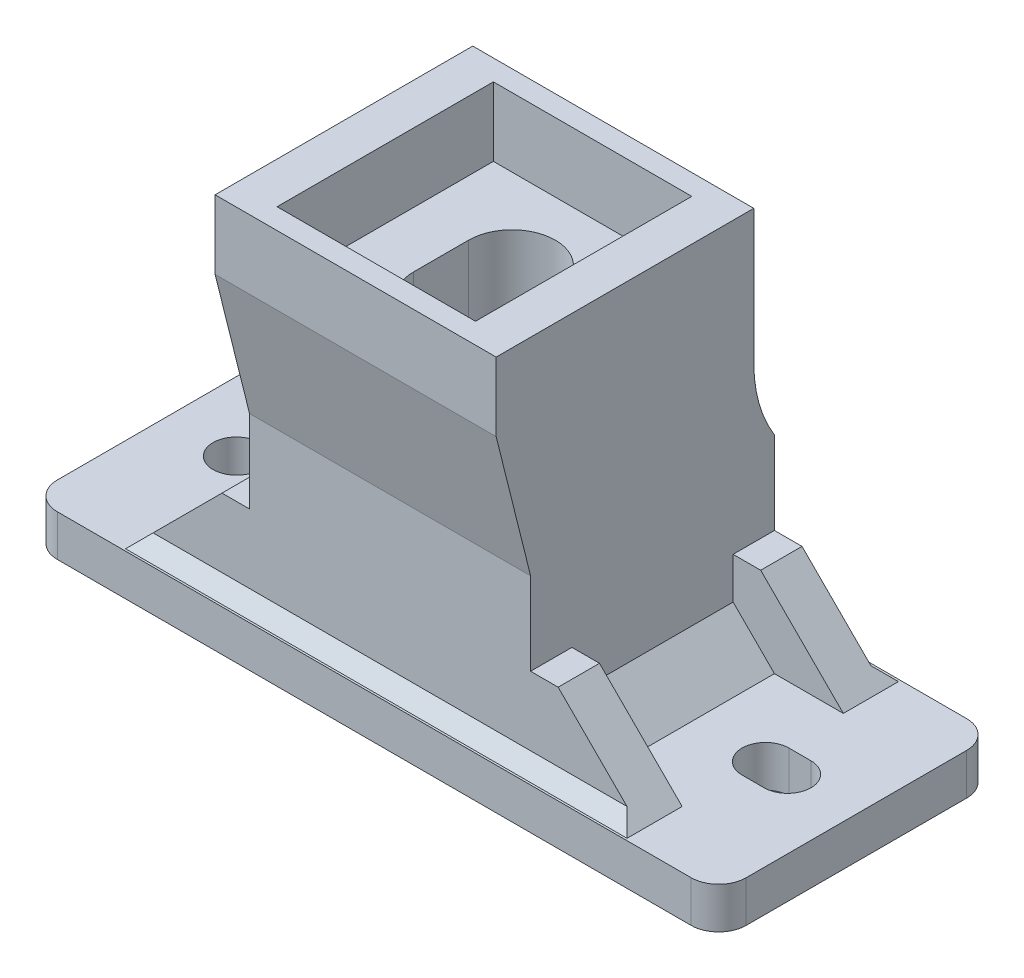
from build123d import *

# Parameters (mm, degrees)
SKETCH1_W               = 20.4
SKETCH1_H               = 17.7
SKETCH1_W_2             = 14.4
SKETCH1_H_2             = 11.7
SKETCH1_R               = 3.15
BOSS_EXTRUDE1_DEPTH     = 25
SKETCH1_3_W             = 20.4
SKETCH1_3_H             = 17.7
SKETCH1_3_W_2           = 14.4
SKETCH1_3_H_2           = 11.7
BOSS_EXTRUDE2_DEPTH     = 30
SKETCH2_W               = 22.449827962
SKETCH2_H               = 3
CUT_EXTRUDE1_DEPTH      = 15
FILLET1_R               = 10
SKETCH3_W               = 50
SKETCH3_H               = 20
SKETCH3_R               = 3.15
BOSS_EXTRUDE3_DEPTH     = 3
SKETCH4_R               = 1.7
CUT_EXTRUDE2_DEPTH      = 39.13135193
BOSS_EXTRUDE4_DEPTH     = 3
BOSS_EXTRUDE5_DEPTH     = 3
CHAMFER1_SIZE           = 3
CHAMFER2_SIZE           = 1
FILLET3_R               = 2
SKETCH7_W               = 14.4
SKETCH7_H               = 3
CUT_EXTRUDE3_DEPTH      = 5
BOSS_EXTRUDE6_DEPTH     = 5
CUT_EXTRUDE4_DEPTH      = 38.132499243
CUT_EXTRUDE4_DEPTH_BACK = 38.132499243
BOSS_EXTRUDE7_DEPTH     = 20.4


with BuildPart() as part:
    # Sketch1 → Boss-Extrude1 (new body)
    # profile 1 of 2: a face of its own
    with BuildSketch(Plane(origin=(0, 0, 0), x_dir=(1, 0, 0), z_dir=(0, 1, 0))):
        Rectangle(SKETCH1_W, SKETCH1_H)
        Rectangle(SKETCH1_W_2, SKETCH1_H_2, mode=Mode.SUBTRACT)
    # profile 2 of 2: a face of its own
    with BuildSketch(Plane(origin=(0, 0, 0), x_dir=(1, 0, 0), z_dir=(0, 1, 0))):
        Rectangle(SKETCH1_W_2, SKETCH1_H_2)
        with Locations(Location((0, 0, 0), (0, 0, 270))):
            Circle(SKETCH1_R, mode=Mode.SUBTRACT)
    extrude(amount=BOSS_EXTRUDE1_DEPTH)

    # Sketch1<3> → Boss-Extrude2 (add)
    with BuildSketch(Plane(origin=(0, 0, 0), x_dir=(1, 0, 0), z_dir=(0, 1, 0))):
        Rectangle(SKETCH1_3_W, SKETCH1_3_H)
        Rectangle(SKETCH1_3_W_2, SKETCH1_3_H_2, mode=Mode.SUBTRACT)
    extrude(amount=BOSS_EXTRUDE2_DEPTH)

    # Sketch2 → Cut-Extrude1 (cut)
    with BuildSketch(Plane(origin=(0, 30, 0), x_dir=(1, 0, 0), z_dir=(0, 1, 0))):
        with Locations((0, 8.85)):
            Rectangle(SKETCH2_W, SKETCH2_H)
    extrude(amount=-CUT_EXTRUDE1_DEPTH, mode=Mode.SUBTRACT)

    # Fillet1
    # the kernel refuses this fillet: 10 mm, written as the material it adds along each edge
    with BuildSketch(Plane(origin=(10.2, 15, -7.35), x_dir=(0, 1, 0), z_dir=(-1, 0, 0))) as fillet1_piece_1:
        with BuildLine():
            CenterArc((5.267826876, 10), FILLET1_R, 238.211669383, 31.788330617)
            Line((0, 1.5), (-0.105356538, 1.33))
            ThreePointArc((-0.105356538, 1.33), (-0.2, 0.75), (-0.2, 0))
            Line((-0.2, 0), (0, -0.2))
            Line((0, -0.2), (5.267826876, -0.2))
            Line((5.267826876, -0.2), (5.267826876, 0))
        make_face()
    extrude(amount=20.4)

    # Sketch3 → Boss-Extrude3 (add)
    with BuildSketch(Plane.XZ):
        Rectangle(SKETCH3_W, SKETCH3_H)
        with Locations(Location((0, 0, 0), (0, 0, 90))):
            Circle(SKETCH3_R, mode=Mode.SUBTRACT)
    extrude(amount=-BOSS_EXTRUDE3_DEPTH)

    # Sketch4 → Cut-Extrude2 (cut, through all)
    with BuildSketch(Plane(origin=(0, 3, 0), x_dir=(1, 0, 0), z_dir=(0, 1, 0))):
        with Locations(Location((-20, 0, 0), (0, 0, 270))):
            Circle(SKETCH4_R)
        with BuildLine():
            Line((18.4, 1.7), (20, 1.7))
            ThreePointArc((20, 1.7), (21.7, 0), (20, -1.7))
            Line((20, -1.7), (18.4, -1.7))
            ThreePointArc((18.4, -1.7), (16.7, 0), (18.4, 1.7))
        make_face()
    extrude(amount=-CUT_EXTRUDE2_DEPTH, mode=Mode.SUBTRACT)

    # Sketch5 → Boss-Extrude4 (add)
    with BuildSketch(Plane(origin=(0, 0, -8.85), x_dir=(-1, 0, 0), z_dir=(0, 0, -1))):
        Polygon((-10.2, 3), (-10.2, 9), (-12.2, 9), (-18.2, 3), align=None)
        Polygon((18.2, 3), (10.2, 3), (10.2, 9), (12.2, 9), align=None)
    extrude(amount=-BOSS_EXTRUDE4_DEPTH)

    # Sketch6 → Boss-Extrude5 (add)
    with BuildSketch(Plane.XY.offset(8.85)):
        Polygon((-18.2, 3), (-10.2, 3), (-10.2, 9), (-12.2, 9), align=None)
        Polygon((10.2, 9), (10.2, 3), (18.2, 3), (12.2, 9), align=None)
    extrude(amount=-BOSS_EXTRUDE5_DEPTH)

    # Chamfer1
    chamfer1_edges = [part.edges().sort_by_distance(p)[0] for p in [
        (-10.2, 3, 0),
        (10.2, 3, 0),
    ]]
    chamfer(chamfer1_edges, length=CHAMFER1_SIZE)

    # Chamfer2
    chamfer2_edges = [part.edges().sort_by_distance(p)[0] for p in [
        (0, 3, -8.85),
        (0, 3, 8.85),
    ]]
    chamfer(chamfer2_edges, length=CHAMFER2_SIZE)

    # Fillet3
    fillet3_edges = [part.edges().sort_by_distance(p)[0] for p in [
        (25, 1.5, 10),
        (25, 1.5, -10),
        (-25, 1.5, -10),
        (-25, 1.5, 10),
    ]]
    fillet(fillet3_edges, radius=FILLET3_R)

    # Sketch7 → Cut-Extrude3 (cut)
    with BuildSketch(Plane(origin=(0, 30, 0), x_dir=(1, 0, 0), z_dir=(0, 1, 0))):
        with Locations((0, -7.35)):
            Rectangle(SKETCH7_W, SKETCH7_H)
    extrude(amount=-CUT_EXTRUDE3_DEPTH, mode=Mode.SUBTRACT)

    # Sketch7<3> → Boss-Extrude6 (add)
    with BuildSketch(Plane(origin=(0, 30, 0), x_dir=(1, 0, 0), z_dir=(0, 1, 0))):
        Polygon((-7.2, -9.85), (-7.2, -8.85), (-10.2, -8.85), (-10.2, -11.35), (10.2, -11.35), (10.2, -8.85), (7.2, -8.85), (7.2, -9.85), align=None)
    extrude(amount=-BOSS_EXTRUDE6_DEPTH)

    # Sketch8 → Cut-Extrude4 (cut, two sides: drawn at the far end of the back side and taken through both)
    with BuildSketch(Plane(origin=(0, 25, 0), x_dir=(1, 0, 0), z_dir=(0, 1, 0)).offset(-CUT_EXTRUDE4_DEPTH_BACK)):
        with BuildLine():
            Line((3.15, 0), (3.15, -4))
            ThreePointArc((3.15, -4), (0, -7.15), (-3.15, -4))
            Line((-3.15, -4), (-3.15, 0))
            ThreePointArc((-3.15, 0), (0, 3.15), (3.15, 0))
        make_face()
    extrude(amount=CUT_EXTRUDE4_DEPTH + CUT_EXTRUDE4_DEPTH_BACK, mode=Mode.SUBTRACT)

    # Sketch9 → Boss-Extrude7 (add)
    with BuildSketch(Plane.ZY.offset(10.2)):
        Polygon((11.35, 25), (8.85, 25), (8.85, 15), align=None)
    extrude(amount=-BOSS_EXTRUDE7_DEPTH)


solid = part.part
